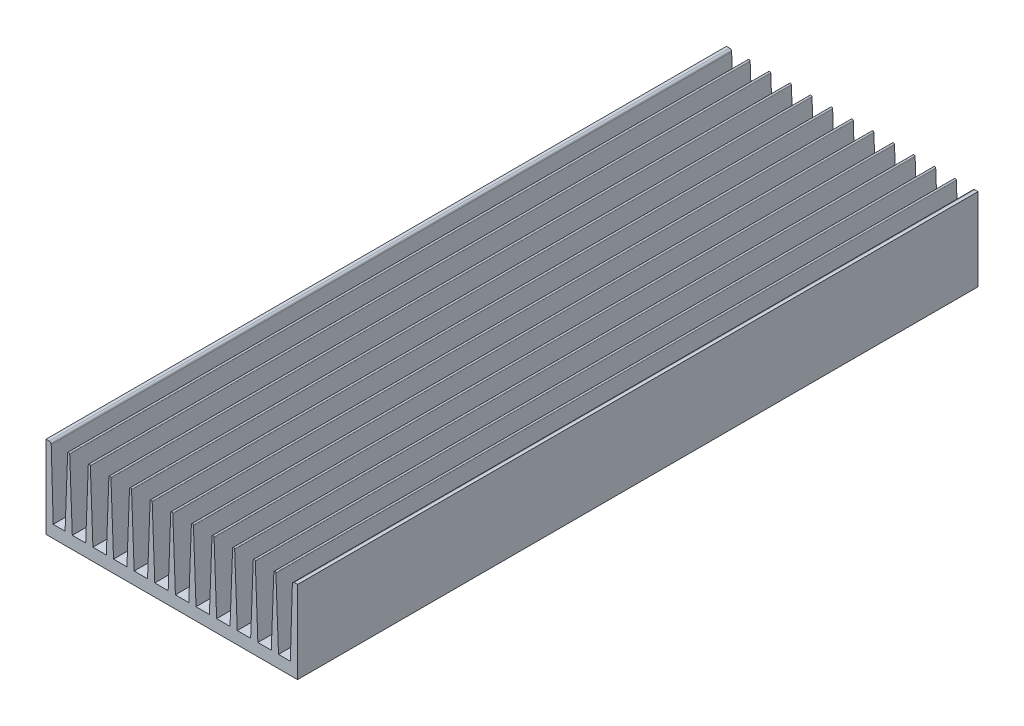
from build123d import *

# Parameters (mm, degrees)
EXTRUDE_1_DEPTH       = 330
EXTRUDE_3_DEPTH       = 330
PATTERN_CURVE_1_COUNT = 11
PATTERN_CURVE_1_PITCH = 10
SKETCH_3_R            = 1.6
CUT_EXTRUDE_1_DEPTH   = 6


with BuildPart() as part:
    # Эскиз1 → Вытянуть1 (new body)
    with BuildSketch(Plane.XY):
        with BuildLine():
            Line((0, 40), (1.528979332, 40))
            ThreePointArc((1.528979332, 40), (2.225614441, 39.717425624), (2.528547087, 39.029399052))
            Line((2.528547087, 39.029399052), (3.5, 6))
            Line((3.5, 6), (118.5, 6))
            Line((118.5, 6), (119.471452913, 39.029399052))
            ThreePointArc((119.471452913, 39.029399052), (119.774385559, 39.717425624), (120.471020668, 40))
            Line((120.471020668, 40), (122, 40))
            Line((122, 40), (122, 0))
            Line((122, 0), (0, 0))
            Line((0, 0), (0, 40))
        make_face()
    extrude(amount=EXTRUDE_1_DEPTH)

    # Эскиз2 → Вытянуть3 (add)
    with BuildSketch(Plane.XY.offset(330)):
        with BuildLine():
            Line((10.5, 39.5), (9.25, 6))
            Line((9.25, 6), (12.75, 6))
            Line((12.75, 6), (11.5, 39.5))
            ThreePointArc((11.5, 39.5), (11, 40), (10.5, 39.5))
        make_face()
    extrude_3 = extrude(amount=-EXTRUDE_3_DEPTH)

    # Кривая1: Вытянуть3 ×11
    with Locations(*[(i * PATTERN_CURVE_1_PITCH, 0, 0) for i in range(1, PATTERN_CURVE_1_COUNT)]):
        add(extrude_3)

    # Эскиз3 → Вырез-Вытянуть1 (cut)
    with BuildSketch(Plane.XZ):
        with Locations((28, 321.5)):
            Circle(SKETCH_3_R)
        with Locations((94, 321.5)):
            Circle(SKETCH_3_R)
        with Locations((94, 8.5)):
            Circle(SKETCH_3_R)
        with Locations((28, 8.5)):
            Circle(SKETCH_3_R)
    extrude(amount=-CUT_EXTRUDE_1_DEPTH, mode=Mode.SUBTRACT)


solid = part.part
